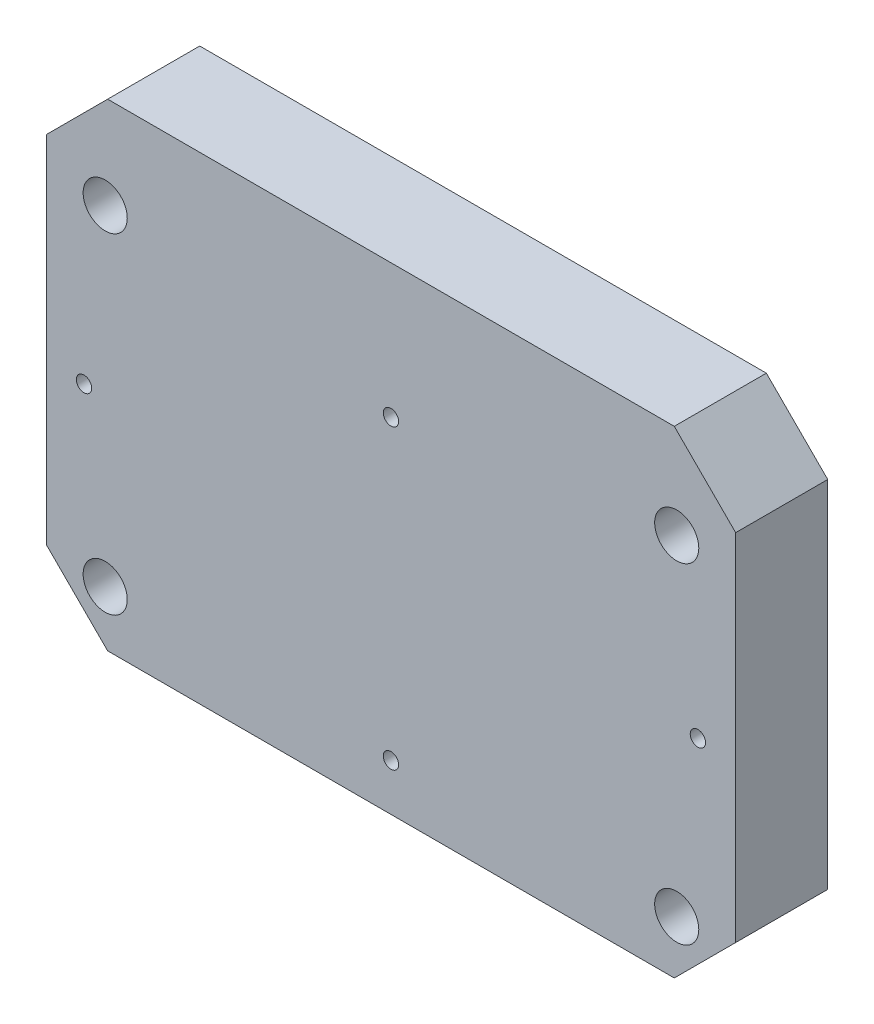
from build123d import *

# Parameters (mm, degrees)
SKETCH1_W                        = 142.628975504
SKETCH1_H                        = 98.843650928
BOSS_EXTRUDE1_DEPTH              = 19.05
CHAMFER1_SIZE                    = 12.7
F_23_64_0_35938_DIAMETER_HOLE1_D = 9.128252
HOLE1_D                          = 3.175
HOLE1_DEPTH                      = 44.45
HOLE1_CSINK_D                    = 10.16
HOLE1_CSINK_ANGLE                = 82
HOLE1_TIP                        = 0.953866233


with BuildPart() as part:
    # Sketch1 → Boss-Extrude1 (new body)
    with BuildSketch(Plane.XY):
        with Locations((0, 439.814227158)):
            Rectangle(SKETCH1_W, SKETCH1_H)
    extrude(amount=BOSS_EXTRUDE1_DEPTH)

    # Chamfer1
    chamfer1_edges = [part.edges().sort_by_distance(p)[0] for p in [
        (-71.314487752, 390.392401694, 9.525),
        (-71.314487752, 489.236052622, 9.525),
        (71.314487752, 390.392401694, 9.525),
        (71.314487752, 489.236052622, 9.525),
    ]]
    chamfer(chamfer1_edges, length=CHAMFER1_SIZE)

    # 23/64 (0.35938) Diameter Hole1 (through all)
    with Locations(Plane.XY.offset(19.05)):
        with Locations((-59.12, 469.942526688), (59.12, 469.942526688), (59.12, 401.616526688), (-59.12, 401.616526688)):
            Hole(F_23_64_0_35938_DIAMETER_HOLE1_D / 2)

    # Hole1
    with Locations(Plane(origin=(0, 0, -19.05), x_dir=(-1, 0, 0), z_dir=(0, 0, -1))):
        with Locations((63.5, 435.779526688), (-63.5, 435.779526688), (0, 461.558384256), (0, 400.075074406)):
            CounterSinkHole(HOLE1_D / 2, HOLE1_CSINK_D / 2, depth=HOLE1_DEPTH, counter_sink_angle=HOLE1_CSINK_ANGLE)
            with Locations((0, 0, -(HOLE1_DEPTH + HOLE1_TIP / 2))):  # 118° drill point
                Cone(0, HOLE1_D / 2, HOLE1_TIP, mode=Mode.SUBTRACT)


solid = part.part
